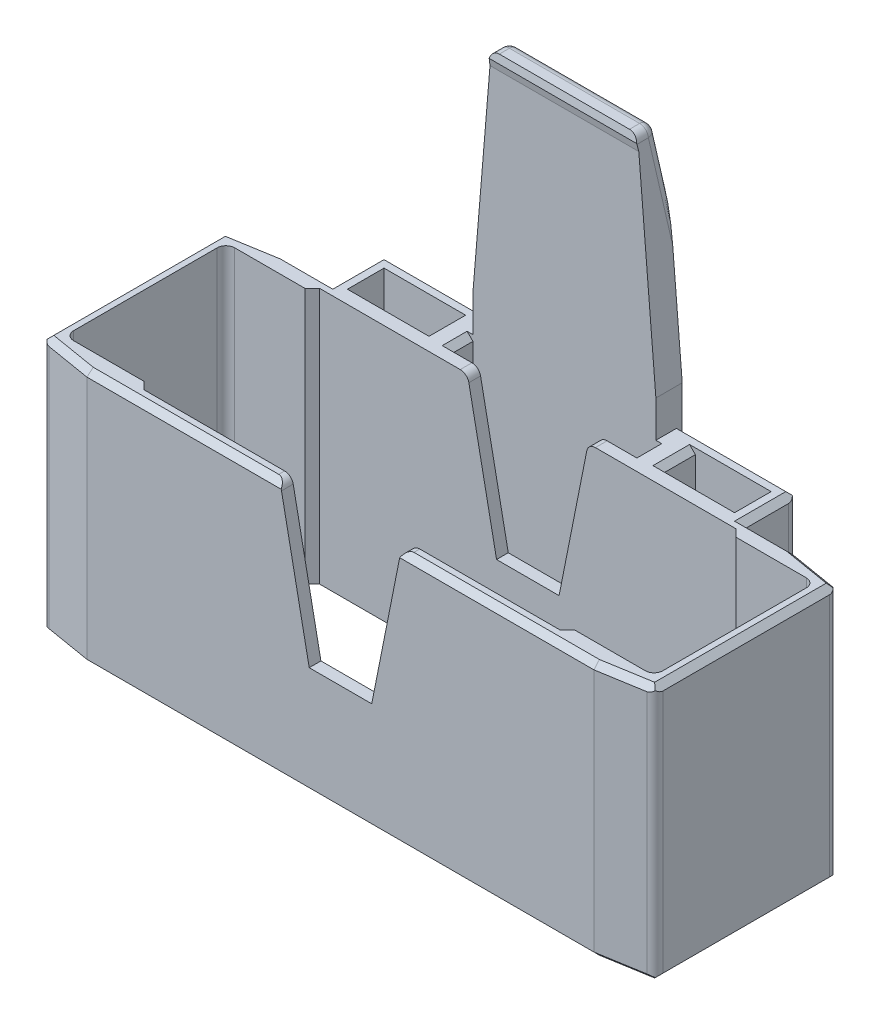
from build123d import *
from OCP.BRepFilletAPI import BRepFilletAPI_MakeChamfer

# Parameters (mm, degrees)
SKETCH1_W                      = 83.7
SKETCH1_H                      = 27.2
BOSS_EXTRUDE1_DEPTH            = 35
CUT_EXTRUDE1_REACH             = 58.226
SKETCH3_W                      = 56.5
SKETCH3_H                      = 3.4
BOSS_EXTRUDE2_DEPTH            = 3.2
SKETCH4_W                      = 56.5
SKETCH4_H                      = 3.6
BOSS_EXTRUDE3_DEPTH            = 70
CUT_EXTRUDE2_START             = -20.6
SKETCH5_W                      = 15.75
SKETCH5_H                      = 35
CUT_EXTRUDE2_DEPTH             = 3.6
SKETCH6_W                      = 15.75
SKETCH6_H                      = 3.4
BOSS_EXTRUDE4_DEPTH            = 35
CUT_EXTRUDE3_REACH             = 86.118
SKETCH7_W                      = 25
SKETCH7_H                      = 3.4
CUT_EXTRUDE4_START             = -20.6
CUT_EXTRUDE4_DEPTH             = 3.6
CUT_EXTRUDE5_REACH             = 86.118
SKETCH9_W                      = 10.35
SKETCH9_H                      = 5
CUT_EXTRUDE6_REACH             = 86.118
CUT_EXTRUDE6_DIRECTION_2_REACH = 86.118
SKETCH11_W                     = 10
SKETCH11_H                     = 1.6
BOSS_EXTRUDE5_DEPTH            = 35
BOSS_EXTRUDE6_START            = -17
BOSS_EXTRUDE6_DEPTH            = 0.2
CHAMFER1_SIZE                  = 7.2
CHAMFER1_SIZE2                 = 1.2
CHAMFER2_SIZE                  = 1.2
CHAMFER2_SIZE2                 = 7.2
CHAMFER3_SIZE                  = 1.2
CHAMFER4_SIZE                  = 0.8
CHAMFER5_SIZE                  = 0.2
CHAMFER5_SIZE_2                = 1
FILLET1_R                      = 1.2


# Some blends are built 0.0001 mm under size
with BuildPart() as part:
    # Sketch1 → Boss-Extrude1 (new body)
    with BuildSketch(Plane(origin=(0, 0, 0), x_dir=(1, 0, 0), z_dir=(0, 1, 0))):
        Rectangle(SKETCH1_W, SKETCH1_H)
    extrude(amount=BOSS_EXTRUDE1_DEPTH)

    # Sketch2 → Cut-Extrude1 (cut, up to next)
    with BuildSketch(Plane(origin=(0, 0, 0), x_dir=(1, 0, 0), z_dir=(0, 1, 0)), mode=Mode.PRIVATE) as cut_extrude1_sk1:
        Polygon((-28.25, 12), (-28.25, 11), (-40.25, 11), (-40.25, -11), (-28.25, -11), (-28.25, -12), (28.25, -12), (28.25, -11), (40.25, -11), (40.25, 11), (28.25, 11), (28.25, 12), align=None)
    cut_extrude1_tool1 = extrude(cut_extrude1_sk1.sketch, amount=CUT_EXTRUDE1_REACH, mode=Mode.PRIVATE) & part.part
    add(cut_extrude1_tool1.solids().sort_by_distance((0, 0, 0))[0], mode=Mode.SUBTRACT)

    # Sketch3 → Boss-Extrude2 (add)
    with BuildSketch(Plane(origin=(0, 0, 0), x_dir=(1, 0, 0), z_dir=(0, 1, 0))):
        with Locations((0, 15.3)):
            Rectangle(SKETCH3_W, SKETCH3_H)
    extrude(amount=BOSS_EXTRUDE2_DEPTH)

    # Sketch4 → Boss-Extrude3 (add)
    with BuildSketch(Plane(origin=(0, 0, 0), x_dir=(1, 0, 0), z_dir=(0, 1, 0))):
        with Locations((0, 18.8)):
            Rectangle(SKETCH4_W, SKETCH4_H)
    extrude(amount=BOSS_EXTRUDE3_DEPTH)

    # Sketch5 → Cut-Extrude2 (cut)
    with BuildSketch(Plane.XY.offset(CUT_EXTRUDE2_START)):
        with Locations((-20.375, 52.5)):
            Rectangle(SKETCH5_W, SKETCH5_H)
        with Locations((20.375, 52.5)):
            Rectangle(SKETCH5_W, SKETCH5_H)
    extrude(amount=CUT_EXTRUDE2_DEPTH, mode=Mode.SUBTRACT)

    # Sketch6 → Boss-Extrude4 (add)
    with BuildSketch(Plane(origin=(0, 0, 0), x_dir=(1, 0, 0), z_dir=(0, 1, 0))):
        with Locations((-20.375, 15.3)):
            Rectangle(SKETCH6_W, SKETCH6_H)
        with Locations((20.375, 15.3)):
            Rectangle(SKETCH6_W, SKETCH6_H)
    extrude(amount=BOSS_EXTRUDE4_DEPTH)

    # Sketch7 → Cut-Extrude3 (cut, up to next)
    with BuildSketch(Plane(origin=(0, 0, 0), x_dir=(1, 0, 0), z_dir=(0, 1, 0)), mode=Mode.PRIVATE) as cut_extrude3_sk1:
        with Locations((0, 15.3)):
            Rectangle(SKETCH7_W, SKETCH7_H)
    cut_extrude3_tool1 = extrude(cut_extrude3_sk1.sketch, amount=CUT_EXTRUDE3_REACH, mode=Mode.PRIVATE) & part.part
    add(cut_extrude3_tool1.solids().sort_by_distance((0, 0, -15.3))[0], mode=Mode.SUBTRACT)

    # Sketch8 → Cut-Extrude4 (cut)
    with BuildSketch(Plane.XY.offset(CUT_EXTRUDE4_START)):
        Polygon((12.5, 40), (10, 70), (12.5, 70), align=None)
        Polygon((-12.5, 70), (-10, 70), (-12.5, 40), align=None)
    extrude(amount=CUT_EXTRUDE4_DEPTH, mode=Mode.SUBTRACT)

    # Sketch9 → Cut-Extrude5 (cut, up to next)
    with BuildSketch(Plane(origin=(0, 0, 0), x_dir=(1, 0, 0), z_dir=(0, 1, 0)), mode=Mode.PRIVATE) as cut_extrude5_sk1:
        with Locations((-21.275, 16.3)):
            Rectangle(SKETCH9_W, SKETCH9_H)
    cut_extrude5_tool1 = extrude(cut_extrude5_sk1.sketch, amount=CUT_EXTRUDE5_REACH, mode=Mode.PRIVATE) & part.part
    # Sketch9 → Cut-Extrude5 (cut, up to next)
    with BuildSketch(Plane(origin=(0, 0, 0), x_dir=(1, 0, 0), z_dir=(0, 1, 0)), mode=Mode.PRIVATE) as cut_extrude5_sk2:
        with Locations((21.275, 16.3)):
            Rectangle(SKETCH9_W, SKETCH9_H)
    cut_extrude5_tool2 = extrude(cut_extrude5_sk2.sketch, amount=CUT_EXTRUDE5_REACH, mode=Mode.PRIVATE) & part.part
    add(cut_extrude5_tool1.solids().sort_by_distance((-21.275, 0, -16.3))[0], mode=Mode.SUBTRACT)
    add(cut_extrude5_tool2.solids().sort_by_distance((21.275, 0, -16.3))[0], mode=Mode.SUBTRACT)

    # Sketch10 → Cut-Extrude6 (cut, up to next)
    with BuildSketch(Plane.XY, mode=Mode.PRIVATE) as cut_extrude6_sk1:
        Polygon((-8.25, 35), (8.25, 35), (4.271752652, 15), (-4.271752652, 15), align=None)
    cut_extrude6_tool1 = extrude(cut_extrude6_sk1.sketch, amount=-CUT_EXTRUDE6_REACH, mode=Mode.PRIVATE) & part.part
    add(cut_extrude6_tool1.solids().sort_by_distance((0, 26.059023, 0))[0], mode=Mode.SUBTRACT)

    # Sketch10 → Cut-Extrude6 direction 2 (cut, up to next)
    with BuildSketch(Plane.XY, mode=Mode.PRIVATE) as cut_extrude6_direction_2_sk1:
        Polygon((-8.25, 35), (8.25, 35), (4.271752652, 15), (-4.271752652, 15), align=None)
    cut_extrude6_direction_2_tool1 = extrude(cut_extrude6_direction_2_sk1.sketch, amount=CUT_EXTRUDE6_DIRECTION_2_REACH, mode=Mode.PRIVATE) & part.part
    add(cut_extrude6_direction_2_tool1.solids().sort_by_distance((0, 26.059023, 0))[0], mode=Mode.SUBTRACT)

    # Sketch11 → Boss-Extrude5 (add)
    with BuildSketch(Plane(origin=(0, 0, 0), x_dir=(1, 0, 0), z_dir=(0, 1, 0))):
        with Locations((0, 21.4)):
            Rectangle(SKETCH11_W, SKETCH11_H)
    extrude(amount=BOSS_EXTRUDE5_DEPTH)

    # Sketch12 → Boss-Extrude6 (add)
    with BuildSketch(Plane.XY.offset(BOSS_EXTRUDE6_START)):
        Polygon((-10, 70), (-10.166666667, 68), (10.166666667, 68), (10, 70), align=None)
    extrude(amount=BOSS_EXTRUDE6_DEPTH)

    # Chamfer1: one chamfer whose edges measure the first distance from different faces: ONE call of the kernel's chamfer builder (chamfer() names one face for all edges)
    chamfer1_edges_1 = [part.edges().sort_by_distance(p)[0] for p in [
        (0, 70, -20.6),
    ]]
    chamfer1_side_1 = [part.faces().sort_by_distance(p)[0] for p in [
        (16.625, 0.899569341, -20.6),
    ]]
    chamfer1_edges_2 = [part.edges().sort_by_distance(p)[0] for p in [
        (-41.85, 17.5, -13.6),
    ]]
    chamfer1_side_2 = [part.faces().sort_by_distance(p)[0] for p in [
        (-35.05, 17.5, -13.6),
    ]]
    chamfer1_edges_3 = [part.edges().sort_by_distance(p)[0] for p in [
        (41.85, 17.5, 13.6),
    ]]
    chamfer1_side_3 = [part.faces().sort_by_distance(p)[0] for p in [
        (0, 0.907231503, 13.6),
    ]]
    chamfer1 = BRepFilletAPI_MakeChamfer(part.part.solid().wrapped)
    for e in chamfer1_edges_1:
        chamfer1.Add(CHAMFER1_SIZE, CHAMFER1_SIZE2, e.wrapped, chamfer1_side_1[0].wrapped)  # the first distance lies on this face
    for e in chamfer1_edges_2:
        chamfer1.Add(CHAMFER1_SIZE, CHAMFER1_SIZE2, e.wrapped, chamfer1_side_2[0].wrapped)  # the first distance lies on this face
    for e in chamfer1_edges_3:
        chamfer1.Add(CHAMFER1_SIZE, CHAMFER1_SIZE2, e.wrapped, chamfer1_side_3[0].wrapped)  # the first distance lies on this face
    add(Compound.cast(chamfer1.Shape()), mode=Mode.REPLACE)

    # Chamfer2: one chamfer whose edges measure the first distance from different faces: ONE call of the kernel's chamfer builder (chamfer() names one face for all edges)
    chamfer2_edges_1 = [part.edges().sort_by_distance(p)[0] for p in [
        (41.85, 17.5, -13.6),
    ]]
    chamfer2_side_1 = [part.faces().sort_by_distance(p)[0] for p in [
        (41.85, 17.5, -0.6),
    ]]
    chamfer2_edges_2 = [part.edges().sort_by_distance(p)[0] for p in [
        (-41.85, 17.5, 13.6),
    ]]
    chamfer2_side_2 = [part.faces().sort_by_distance(p)[0] for p in [
        (-41.85, 17.5, 0.6),
    ]]
    chamfer2 = BRepFilletAPI_MakeChamfer(part.part.solid().wrapped)
    for e in chamfer2_edges_1:
        chamfer2.Add(CHAMFER2_SIZE, CHAMFER2_SIZE2, e.wrapped, chamfer2_side_1[0].wrapped)  # the first distance lies on this face
    for e in chamfer2_edges_2:
        chamfer2.Add(CHAMFER2_SIZE, CHAMFER2_SIZE2, e.wrapped, chamfer2_side_2[0].wrapped)  # the first distance lies on this face
    add(Compound.cast(chamfer2.Shape()), mode=Mode.REPLACE)

    # Chamfer3
    # the kernel refuses this chamfer: 1.2 mm, written as the material it takes off along each edge
    with BuildSketch(Plane(origin=(28.25, -3.086019586, -11), x_dir=(0.9996219169112968, 0, 0.027495876610585904), z_dir=(0, 1, 0))) as chamfer3_piece_1_section:
        Polygon((CHAMFER3_SIZE * 0.999621916911, CHAMFER3_SIZE * 0.0274958766106), (-CHAMFER3_SIZE * 0.0274958766106, CHAMFER3_SIZE * 0.999621916911), (0, 0), align=None)
    chamfer3_piece_1 = extrude(amount=41.172039171, mode=Mode.PRIVATE)
    chamfer3_piece_1 = split(chamfer3_piece_1, bisect_by=Plane(origin=(28.660431829, 17.5, -12), z_dir=(0, 0, 1)), keep=Keep.TOP, mode=Mode.PRIVATE)
    add(chamfer3_piece_1, mode=Mode.SUBTRACT)
    with BuildSketch(Plane(origin=(28.25, -3.086019586, 11), x_dir=(-0.027495876610587378, 0, 0.9996219169112965), z_dir=(0, 1, 0))) as chamfer3_piece_2_section:
        Polygon((CHAMFER3_SIZE * 0.999621916911, CHAMFER3_SIZE * 0.0274958766106), (-CHAMFER3_SIZE * 0.0274958766106, CHAMFER3_SIZE * 0.999621916911), (0, 0), align=None)
    chamfer3_piece_2 = extrude(amount=41.172039171, mode=Mode.PRIVATE)
    chamfer3_piece_2 = split(chamfer3_piece_2, bisect_by=Plane(origin=(28.660431829, 17.5, 12), z_dir=(0, 0, -1)), keep=Keep.TOP, mode=Mode.PRIVATE)
    add(chamfer3_piece_2, mode=Mode.SUBTRACT)
    with BuildSketch(Plane(origin=(-28.25, -3.086019586, 11), x_dir=(-0.9996219169112968, 0, -0.027495876610585904), z_dir=(0, 1, 0))) as chamfer3_piece_3_section:
        Polygon((CHAMFER3_SIZE * 0.999621916911, CHAMFER3_SIZE * 0.0274958766106), (-CHAMFER3_SIZE * 0.0274958766106, CHAMFER3_SIZE * 0.999621916911), (0, 0), align=None)
    chamfer3_piece_3 = extrude(amount=41.172039171, mode=Mode.PRIVATE)
    chamfer3_piece_3 = split(chamfer3_piece_3, bisect_by=Plane(origin=(-28.660431829, 17.5, 12), z_dir=(0, 0, -1)), keep=Keep.TOP, mode=Mode.PRIVATE)
    add(chamfer3_piece_3, mode=Mode.SUBTRACT)
    with BuildSketch(Plane(origin=(-28.25, -3.086019586, -11), x_dir=(0.027495876610587378, 0, -0.9996219169112965), z_dir=(0, 1, 0))) as chamfer3_piece_4_section:
        Polygon((CHAMFER3_SIZE * 0.999621916911, CHAMFER3_SIZE * 0.0274958766106), (-CHAMFER3_SIZE * 0.0274958766106, CHAMFER3_SIZE * 0.999621916911), (0, 0), align=None)
    chamfer3_piece_4 = extrude(amount=41.172039171, mode=Mode.PRIVATE)
    chamfer3_piece_4 = split(chamfer3_piece_4, bisect_by=Plane(origin=(-28.660431829, 17.5, -12), z_dir=(0, 0, 1)), keep=Keep.TOP, mode=Mode.PRIVATE)
    add(chamfer3_piece_4, mode=Mode.SUBTRACT)
    with BuildSketch(Plane(origin=(-5, -3.086019586, -22.2), x_dir=(-0.027495876610586622, 0, 0.9996219169112968), z_dir=(0, 1, 0)), Plane(origin=(5, -3.086019586, -22.2), x_dir=(-0.9996219169112968, 0, -0.027495876610587354), z_dir=(0, 1, 0))) as chamfer3_piece_5:
        Polygon((CHAMFER3_SIZE * 0.999621916911, CHAMFER3_SIZE * 0.0274958766106), (-CHAMFER3_SIZE * 0.0274958766106, CHAMFER3_SIZE * 0.999621916911), (0, 0), align=None)
    extrude(amount=41.172039171, mode=Mode.SUBTRACT)

    # Chamfer4
    chamfer4_edges = [part.edges().sort_by_distance(p)[0] for p in [
        (-38.25, 0, 13),
        (0, 0, 13.6),
        (38.25, 0, 13),
        (41.85, 0, 0),
        (38.25, 0, -13),
        (31.45, 0, -13.6),
        (28.25, 0, -17.1),
        (16.625, 0, -20.6),
        (5, 0, -20.8),
        (-5, 0, -20.8),
        (-16.625, 0, -20.6),
        (-28.25, 0, -17.1),
        (-31.45, 0, -13.6),
        (-38.25, 0, -13),
        (-41.85, 0, 0),
        (16.1, 0, -16.3),
        (-12.5, 0, -15.3),
        (12.5, 0, -15.3),
        (-16.1, 0, -16.3),
        (-38.25, 35, 13),
        (-21.45, 35, 13.6),
        (21.45, 35, 13.6),
        (38.25, 35, 13),
        (41.85, 35, 0),
        (38.25, 35, -13),
        (31.45, 35, -13.6),
        (28.25, 35, -17.1),
        (-20.375, 35, -20.6),
        (20.375, 35, -20.6),
        (-28.25, 35, -17.1),
        (-31.45, 35, -13.6),
        (-38.25, 35, -13),
        (-41.85, 35, 0),
        (16.1, 35, -16.3),
        (-12.5, 35, -15.3),
        (12.5, 35, -15.3),
        (-16.1, 35, -16.3),
    ]]
    chamfer(chamfer4_edges, length=CHAMFER4_SIZE)

    # Chamfer5
    chamfer5_edges_1 = [part.edges().sort_by_distance(p)[0] for p in [
        (0, 68, -16.8),
    ]]
    chamfer5_side_1 = [part.faces().sort_by_distance(p)[0] for p in [
        (0, 68, -16.804),
    ]]
    chamfer5_edges_2 = [part.edges().sort_by_distance(p)[0] for p in [
        (0, 70, -16.8),
    ]]
    chamfer5_side_2 = [part.faces().sort_by_distance(p)[0] for p in [
        (0, 69.996, -16.8),
    ]]
    chamfer5 = BRepFilletAPI_MakeChamfer(part.part.solid().wrapped)
    for e in chamfer5_edges_1:
        chamfer5.Add(CHAMFER5_SIZE - 0.0001, CHAMFER5_SIZE_2 - 0.0001, e.wrapped, chamfer5_side_1[0].wrapped)
    for e in chamfer5_edges_2:
        chamfer5.Add(CHAMFER5_SIZE_2 - 0.0001, CHAMFER5_SIZE - 0.0001, e.wrapped, chamfer5_side_2[0].wrapped)
    add(Compound.cast(chamfer5.Shape()), mode=Mode.REPLACE)  # a hair under: the kernel refuses the full size

    # Fillet1
    fillet1_edges = [part.edges().sort_by_distance(p)[0] for p in [
        (8.25, 35, -12.8),
        (-8.25, 35, -12.8),
        (-40.25, 17.5, -11),
        (-10, 70, -18.19995),
        (10, 70, -18.19995),
        (0, 70, -19.4),
        (-10.3, 66.4, -20),
        (10.3, 66.4, -20),
        (-40.25, 17.5, 11),
        (40.25, 17.5, 11),
        (40.25, 17.5, -11),
        (-8.25, 35, 12.4),
        (8.25, 35, 12.4),
        (28.25, 17.5, -20.6),
        (-28.25, 17.5, -20.6),
        (41.85, 17.5, -12.4),
        (41.85, 17.5, 12.4),
        (-41.85, 17.5, -12.4),
        (-41.85, 17.5, 12.4),
    ]]
    fillet(fillet1_edges, radius=FILLET1_R)


solid = part.part
